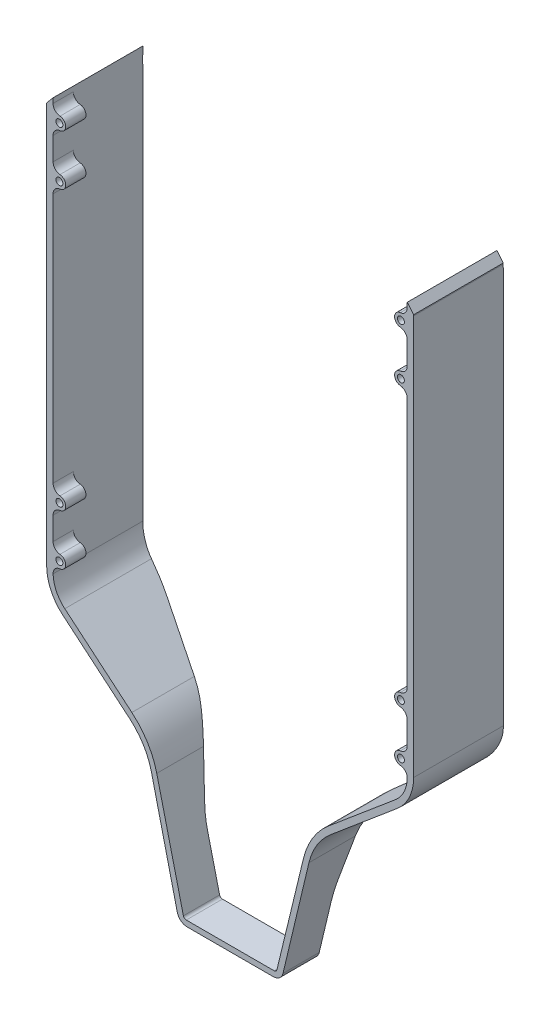
from build123d import *

# Parameters (mm, degrees)
BOSS_EXTRUDE4_DEPTH     = 60
CUT_EXTRUDE1_DEPTH      = 200.185236193
CUT_EXTRUDE1_DEPTH_BACK = 200.185236193
SKETCH8_W               = 377.363073988
SKETCH8_H               = 227.050506132
CUT_EXTRUDE2_DEPTH      = 15.88
CUT_EXTRUDE3_DEPTH      = 197.747566791
CUT_EXTRUDE3_DEPTH_BACK = 197.747566791
SKETCH9_W               = 130.37321108
SKETCH9_H               = 280.151546647
BOSS_EXTRUDE5_DEPTH     = 35.450757786
SKETCH12_R              = 1.375
BOSS_EXTRUDE6_DEPTH     = 8
FILLET1_R               = 3


with BuildPart() as part:
    # Sketch6 → Boss-Extrude4 (new body)
    with BuildSketch(Plane(origin=(0, 0, 60), x_dir=(0, 1, 0), z_dir=(0, 0, 1))):
        with BuildLine():
            Line((-102.556726727, -58.78223175), (-90.104281455, -73.5959984))
            ThreePointArc((-90.104281455, -73.5959984), (-83.925616968, -78.330582212), (-76.325663088, -80.013698287))
            Line((-76.325663088, -80.013698287), (81.706464258, -80.013698287))
            ThreePointArc((81.706464258, -80.013698287), (91.86470798, -77.648864496), (99.934033614, -71.040662156))
            Line((99.934033614, -71.040662156), (133.684497307, -27.183065922))
            ThreePointArc((133.684497307, -27.183065922), (134.470930527, -25.715449802), (134.742731928, -24.072739151))
            Line((134.742731928, -24.072739151), (134.742731928, 9.125342578))
            ThreePointArc((134.742731928, 9.125342578), (134.470930527, 10.768053229), (133.684497307, 12.235669349))
            Line((133.684497307, 12.235669349), (99.934033614, 56.093265582))
            ThreePointArc((99.934033614, 56.093265582), (91.86470798, 62.701467923), (81.706464258, 65.066301713))
            Line((81.706464258, 65.066301713), (-76.325663088, 65.066301713))
            ThreePointArc((-76.325663088, 65.066301713), (-83.925616968, 63.383185638), (-90.104281455, 58.648601826))
            Line((-90.104281455, 58.648601826), (-102.556726727, 43.834835176))
            Line((-102.556726727, 43.834835176), (-112.31431086, 32.226948432))
            ThreePointArc((-112.31431086, 32.226948432), (-118.563545676, 26.830262423), (-126.189758735, 23.665135246))
            Line((-126.189758735, 23.665135246), (-169.184498976, 13.419549157))
            ThreePointArc((-169.184498976, 13.419549157), (-171.396449782, 12.007522262), (-172.257268072, 9.528502659))
            Line((-172.257268072, 9.528502659), (-172.257268072, -24.475899233))
            ThreePointArc((-172.257268072, -24.475899233), (-171.396449782, -26.954918836), (-169.184498976, -28.366945731))
            Line((-169.184498976, -28.366945731), (-126.189758735, -38.61253182))
            ThreePointArc((-126.189758735, -38.61253182), (-118.563545676, -41.777658997), (-112.31431086, -47.174345005))
            Line((-112.31431086, -47.174345005), (-102.556726727, -58.78223175))
        make_face()
        with BuildLine():
            Line((-169.177766438, -25.956087723), (-125.671426431, -36.484878628))
            ThreePointArc((-125.671426431, -36.484878628), (-116.929476769, -40.140042352), (-109.763541599, -46.339338996))
            Line((-109.763541599, -46.339338996), (-87.488197255, -72.838692813))
            ThreePointArc((-87.488197255, -72.838692813), (-83.025828459, -76.258114455), (-77.536972879, -77.473698287))
            Line((-77.536972879, -77.473698287), (83.585331343, -77.473698287))
            ThreePointArc((83.585331343, -77.473698287), (91.030563019, -75.756647128), (96.971813087, -70.952348321))
            Line((96.971813087, -70.952348321), (130.310853005, -28.361704701))
            ThreePointArc((130.310853005, -28.361704701), (131.969092573, -25.312660918), (132.542731928, -21.889597327))
            Line((132.542731928, -21.889597327), (132.542731928, 6.942200754))
            ThreePointArc((132.542731928, 6.942200754), (131.969092573, 10.365264345), (130.310853005, 13.414308128))
            Line((130.310853005, 13.414308128), (96.971813087, 56.004951747))
            ThreePointArc((96.971813087, 56.004951747), (91.030563019, 60.809250555), (83.585331343, 62.526301713))
            Line((83.585331343, 62.526301713), (-77.536972879, 62.526301713))
            ThreePointArc((-77.536972879, 62.526301713), (-83.025828459, 61.310717881), (-87.488197255, 57.891296239))
            Line((-87.488197255, 57.891296239), (-109.763541599, 31.391942423))
            ThreePointArc((-109.763541599, 31.391942423), (-116.929476769, 25.192645778), (-125.671426431, 21.537482055))
            Line((-125.671426431, 21.537482055), (-169.177766438, 11.008691149))
            ThreePointArc((-169.177766438, 11.008691149), (-169.811030519, 10.602091868), (-170.057268072, 9.89095655))
            Line((-170.057268072, 9.89095655), (-170.057268072, -24.838353124))
            ThreePointArc((-170.057268072, -24.838353124), (-169.811030519, -25.549488441), (-169.177766438, -25.956087723))
        make_face(mode=Mode.SUBTRACT)
    extrude(amount=-BOSS_EXTRUDE4_DEPTH)

    # Sketch7 → Cut-Extrude1 (cut, two sides: drawn at the far end of the back side and taken through both)
    with BuildSketch(Plane.YZ.offset(-CUT_EXTRUDE1_DEPTH_BACK)):
        with BuildLine():
            Line((-173.316776267, 29.807263028), (-149.349499046, 29.807263028))
            ThreePointArc((-149.349499046, 29.807263028), (-145.147043271, 29.585892535), (-140.991102482, 28.924231301))
            Line((-140.991102482, 28.924231301), (-133.532416413, 27.330481612))
            Line((-133.532416413, 27.330481612), (-125.66880169, 25.650207982))
            ThreePointArc((-125.66880169, 25.650207982), (-121.087734224, 24.396737051), (-116.677475957, 22.634071304))
            Line((-116.677475957, 22.634071304), (-95.011210416, 12.518673634))
            ThreePointArc((-95.011210416, 12.518673634), (-86.549925694, 9.643167514), (-77.66660739, 8.669242214))
            Line((-77.66660739, 8.669242214), (78.614887506, 8.669242214))
            ThreePointArc((78.614887506, 8.669242214), (95.467441046, 11.780338405), (110.098388015, 20.703503267))
            Line((110.098388015, 20.703503267), (118.253034855, 28.004269173))
            ThreePointArc((118.253034855, 28.004269173), (122.189751518, 30.405205481), (126.724230967, 31.242301278))
            Line((126.724230967, 31.242301278), (135.253961988, 31.242301278))
            Line((135.253961988, 31.242301278), (135.253961988, -52.435838827))
            Line((135.253961988, -52.435838827), (-175.257268072, -52.435838827))
            Line((-175.257268072, -52.435838827), (-175.257268072, 29.807263028))
            Line((-175.257268072, 29.807263028), (-173.316776267, 29.807263028))
        make_face()
    extrude(amount=CUT_EXTRUDE1_DEPTH + CUT_EXTRUDE1_DEPTH_BACK, mode=Mode.SUBTRACT)

    # Sketch8 → Cut-Extrude2 (cut)
    with BuildSketch(Plane(origin=(0, 0, 60), x_dir=(0, -1, 0), z_dir=(0, 0, 1))):
        Rectangle(SKETCH8_W, SKETCH8_H)
    extrude(amount=-CUT_EXTRUDE2_DEPTH, mode=Mode.SUBTRACT)

    # Sketch9 → Cut-Extrude3 (cut, two sides: drawn at the far end of the back side and taken through both)
    with BuildSketch(Plane(origin=(0, 0, 60), x_dir=(0, -1, 0), z_dir=(0, 0, 1)).offset(-CUT_EXTRUDE3_DEPTH_BACK)):
        with Locations((-147.289337468, 7.473698286)):
            Rectangle(SKETCH9_W, SKETCH9_H)
    extrude(amount=CUT_EXTRUDE3_DEPTH + CUT_EXTRUDE3_DEPTH_BACK, mode=Mode.SUBTRACT)

    # Sketch10 → Boss-Extrude5 (add)
    with BuildSketch(Plane(origin=(0, 0, 8.669242214), x_dir=(1, 0, 0), z_dir=(0, 0, -1))):
        Polygon((80.01028438, -82.102731928), (77.473698287, -82.102731928), (77.473698287, -85.102731928), align=None)
        Polygon((-62.526301713, -82.102731928), (-62.526301713, -85.102731928), (-65.062887806, -82.102731928), align=None)
    extrude(amount=-BOSS_EXTRUDE5_DEPTH)

    # Sketch12 → Boss-Extrude6 (add)
    # profile 1 of 8: a face of its own
    with BuildSketch(Plane(origin=(0, 0, 44.12), x_dir=(0, -1, 0), z_dir=(0, 0, 1))):
        with BuildLine():
            Line((69.809599415, 74.973698287), (69.809599415, 77.473698287))
            Line((69.809599415, 77.473698287), (74.809599415, 77.473698287))
            Line((74.809599415, 77.473698287), (74.809599415, 74.973698287))
            ThreePointArc((74.809599415, 74.973698287), (72.309599415, 72.473698287), (69.809599415, 74.973698287))
        make_face()
        with Locations(Location((72.309599415, 74.973698287, 0), (0, 0, 90))):
            Circle(SKETCH12_R, mode=Mode.SUBTRACT)
    # profile 2 of 8: a face of its own
    with BuildSketch(Plane(origin=(0, 0, 44.12), x_dir=(0, -1, 0), z_dir=(0, 0, 1))):
        with BuildLine():
            Line((49.809599415, 74.973698287), (49.809599415, 77.473698287))
            Line((49.809599415, 77.473698287), (54.809599415, 77.473698287))
            Line((54.809599415, 77.473698287), (54.809599415, 74.973698287))
            ThreePointArc((54.809599415, 74.973698287), (52.309599415, 72.473698287), (49.809599415, 74.973698287))
        make_face()
        with Locations(Location((52.309599415, 74.973698287, 0), (0, 0, 90))):
            Circle(SKETCH12_R, mode=Mode.SUBTRACT)
    # profile 3 of 8: a face of its own
    with BuildSketch(Plane(origin=(0, 0, 44.12), x_dir=(0, -1, 0), z_dir=(0, 0, 1))):
        with BuildLine():
            Line((-80.190400585, 74.973698287), (-80.190400585, 77.473698287))
            Line((-80.190400585, 77.473698287), (-75.190400585, 77.473698287))
            Line((-75.190400585, 77.473698287), (-75.190400585, 74.973698287))
            ThreePointArc((-75.190400585, 74.973698287), (-77.690400585, 72.473698287), (-80.190400585, 74.973698287))
        make_face()
        with Locations(Location((-77.690400585, 74.973698287, 0), (0, 0, 90))):
            Circle(SKETCH12_R, mode=Mode.SUBTRACT)
    # profile 4 of 8: a face of its own
    with BuildSketch(Plane(origin=(0, 0, 44.12), x_dir=(0, -1, 0), z_dir=(0, 0, 1))):
        with BuildLine():
            Line((-60.190400585, 74.973698287), (-60.190400585, 77.473698287))
            Line((-60.190400585, 77.473698287), (-55.190400585, 77.473698287))
            Line((-55.190400585, 77.473698287), (-55.190400585, 74.973698287))
            ThreePointArc((-55.190400585, 74.973698287), (-57.690400585, 72.473698287), (-60.190400585, 74.973698287))
        make_face()
        with Locations(Location((-57.690400585, 74.973698287, 0), (0, 0, 90))):
            Circle(SKETCH12_R, mode=Mode.SUBTRACT)
    # profile 5 of 8: a face of its own
    with BuildSketch(Plane(origin=(0, 0, 44.12), x_dir=(0, -1, 0), z_dir=(0, 0, 1))):
        with BuildLine():
            Line((74.809599415, -60.026301713), (74.809599415, -62.526301713))
            Line((74.809599415, -62.526301713), (69.809599415, -62.526301713))
            Line((69.809599415, -62.526301713), (69.809599415, -60.026301713))
            ThreePointArc((69.809599415, -60.026301713), (72.309599415, -57.526301713), (74.809599415, -60.026301713))
        make_face()
        with Locations(Location((72.309599415, -60.026301713, 0), (0, 0, 270))):
            Circle(SKETCH12_R, mode=Mode.SUBTRACT)
    # profile 6 of 8: a face of its own
    with BuildSketch(Plane(origin=(0, 0, 44.12), x_dir=(0, -1, 0), z_dir=(0, 0, 1))):
        with BuildLine():
            Line((54.809599415, -60.026301713), (54.809599415, -62.526301713))
            Line((54.809599415, -62.526301713), (49.809599415, -62.526301713))
            Line((49.809599415, -62.526301713), (49.809599415, -60.026301713))
            ThreePointArc((49.809599415, -60.026301713), (52.309599415, -57.526301713), (54.809599415, -60.026301713))
        make_face()
        with Locations(Location((52.309599415, -60.026301713, 0), (0, 0, 270))):
            Circle(SKETCH12_R, mode=Mode.SUBTRACT)
    # profile 7 of 8: a face of its own
    with BuildSketch(Plane(origin=(0, 0, 44.12), x_dir=(0, -1, 0), z_dir=(0, 0, 1))):
        with BuildLine():
            Line((-55.190400585, -60.026301713), (-55.190400585, -62.526301713))
            Line((-55.190400585, -62.526301713), (-60.190400585, -62.526301713))
            Line((-60.190400585, -62.526301713), (-60.190400585, -60.026301713))
            ThreePointArc((-60.190400585, -60.026301713), (-57.690400585, -57.526301713), (-55.190400585, -60.026301713))
        make_face()
        with Locations(Location((-57.690400585, -60.026301713, 0), (0, 0, 270))):
            Circle(SKETCH12_R, mode=Mode.SUBTRACT)
    # profile 8 of 8: a face of its own
    with BuildSketch(Plane(origin=(0, 0, 44.12), x_dir=(0, -1, 0), z_dir=(0, 0, 1))):
        with BuildLine():
            Line((-75.190400585, -60.026301713), (-75.190400585, -62.526301713))
            Line((-75.190400585, -62.526301713), (-80.190400585, -62.526301713))
            Line((-80.190400585, -62.526301713), (-80.190400585, -60.026301713))
            ThreePointArc((-80.190400585, -60.026301713), (-77.690400585, -57.526301713), (-75.190400585, -60.026301713))
        make_face()
        with Locations(Location((-77.690400585, -60.026301713, 0), (0, 0, 270))):
            Circle(SKETCH12_R, mode=Mode.SUBTRACT)
    extrude(amount=-BOSS_EXTRUDE6_DEPTH)

    # Fillet1
    # the kernel refuses this fillet: 3 mm, written as the material it adds along each edge
    with BuildSketch(Plane(origin=(77.473698287, -69.809599415, 44.12), x_dir=(0, 1, 0), z_dir=(0, 0, -1)), Plane(origin=(77.473698287, -49.809599415, 44.12), x_dir=(0, 1, 0), z_dir=(0, 0, -1)), Plane(origin=(77.473698287, 60.190400585, 44.12), x_dir=(0, 1, 0), z_dir=(0, 0, -1)), Plane(origin=(77.473698287, 80.190400585, 44.12), x_dir=(0, 1, 0), z_dir=(0, 0, -1)), Plane(origin=(-62.526301713, 75.190400585, 44.12), x_dir=(0, -1, 0), z_dir=(0, 0, -1)), Plane(origin=(-62.526301713, 55.190400585, 44.12), x_dir=(0, -1, 0), z_dir=(0, 0, -1)), Plane(origin=(-62.526301713, -54.809599415, 44.12), x_dir=(0, -1, 0), z_dir=(0, 0, -1))) as fillet1_piece_1:
        with BuildLine():
            CenterArc((2.977225575, -3), FILLET1_R, 90, 84.78409143)
            Line((-0.010352011, -2.727272727), (-0.30910977, -2.7))
            ThreePointArc((-0.30910977, -2.7), (-0.3, -2.5), (-0.3, 0))
            Line((-0.3, 0), (0, 0.3))
            Line((0, 0.3), (2.977225575, 0.3))
            Line((2.977225575, 0.3), (2.977225575, 0))
        make_face()
    extrude(amount=8)
    with BuildSketch(Plane(origin=(77.473698287, -74.809599415, 44.12), x_dir=(-0.00132677412546265, -0.9999991198348227, 0), z_dir=(0, 0, -1))) as fillet1_piece_2:
        with BuildLine():
            CenterArc((2.980922188, 2.999162296), FILLET1_R, 185.172472526, 86.181570315)
            Line((-0.006861295, 2.72869999), (-0.305639643, 2.701653759))
            ThreePointArc((-0.305639643, 2.701653759), (-0.296682801, 2.500395832), (-0.299999736, 0.000398032))
            Line((-0.299999736, 0.000398032), (-0.000398032, -0.299999736))
            ThreePointArc((-0.000398032, -0.299999736), (2.726973031, -0.303618344), (3.058902198, -0.29991623))
            Line((3.058902198, -0.29991623), (3.051813106, 0))
        make_face()
    extrude(amount=8)
    with BuildSketch(Plane(origin=(77.473698287, -54.809599415, 44.12), x_dir=(0, -1, 0), z_dir=(0, 0, -1)), Plane(origin=(77.473698287, 55.190400585, 44.12), x_dir=(0, -1, 0), z_dir=(0, 0, -1)), Plane(origin=(77.473698287, 75.190400585, 44.12), x_dir=(0, -1, 0), z_dir=(0, 0, -1)), Plane(origin=(-62.526301713, 80.190400585, 44.12), x_dir=(0, 1, 0), z_dir=(0, 0, -1)), Plane(origin=(-62.526301713, 60.190400585, 44.12), x_dir=(0, 1, 0), z_dir=(0, 0, -1)), Plane(origin=(-62.526301713, -49.809599415, 44.12), x_dir=(0, 1, 0), z_dir=(0, 0, -1)), Plane(origin=(-62.526301713, -69.809599415, 44.12), x_dir=(0, 1, 0), z_dir=(0, 0, -1))) as fillet1_piece_3:
        with BuildLine():
            CenterArc((2.977225575, 3), FILLET1_R, 185.21590857, 84.78409143)
            Line((-0.010352011, 2.727272727), (-0.30910977, 2.7))
            ThreePointArc((-0.30910977, 2.7), (-0.3, 2.5), (-0.3, 0))
            Line((-0.3, 0), (0, -0.3))
            Line((0, -0.3), (2.977225575, -0.3))
            Line((2.977225575, -0.3), (2.977225575, 0))
        make_face()
    extrude(amount=8)
    with BuildSketch(Plane(origin=(-62.526301713, -74.809599415, 44.12), x_dir=(0.001326774125462656, -0.9999991198348227, 0), z_dir=(0, 0, -1))) as fillet1_piece_4:
        with BuildLine():
            CenterArc((2.980922188, -2.999162296), FILLET1_R, 88.645957159, 86.181570315)
            Line((-0.006861295, -2.72869999), (-0.305639643, -2.701653759))
            ThreePointArc((-0.305639643, -2.701653759), (-0.296682801, -2.500395832), (-0.299999736, -0.000398032))
            Line((-0.299999736, -0.000398032), (-0.000398032, 0.299999736))
            ThreePointArc((-0.000398032, 0.299999736), (2.726973031, 0.303618344), (3.058902198, 0.29991623))
            Line((3.058902198, 0.29991623), (3.051813106, 0))
        make_face()
    extrude(amount=8)


solid = part.part
